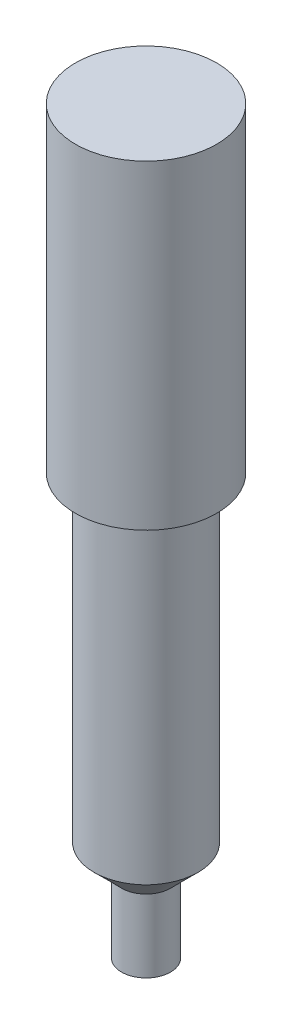
from build123d import *

# Parameters (mm, degrees)
SKETCH2_W     = 12.720955
SKETCH2_H     = 33.02
SKETCH2_W_2   = 5.999999938
SKETCH2_H_2   = 25.4
CHAMFER1_SIZE = 7.62


with BuildPart() as part:
    # Sketch2 → Revolve1 (revolve)
    with BuildSketch(Plane.XY, mode=Mode.PRIVATE) as revolve1_sk:
        with Locations((6.3604775, 86.36)):
            Rectangle(SKETCH2_W, SKETCH2_H)
        Polygon((0, 181.102), (0, 102.87), (12.720955, 102.87), (17.272, 102.87), (17.272, 181.102), align=None)
        Polygon((0, 69.85), (0, 25.4), (5.999999938, 25.4), (12.720955, 25.4), (12.720955, 69.85), align=None)
        with Locations((2.999999969, 12.7)):
            Rectangle(SKETCH2_W_2, SKETCH2_H_2)
    revolve(revolve1_sk.sketch.rotate(Axis((0, 0, 0), (0, 1, 0)), 90), axis=Axis((0, 0, 0), (0, 1, 0)))

    # Chamfer1
    # the kernel refuses this chamfer: 7.62 mm, written as the material it adds along each edge
    with BuildSketch(Plane(origin=(0, 25.4, 0), x_dir=(0, 0, -1), z_dir=(1, 0, 0))) as chamfer1_piece_1_section:
        Polygon((5.999999938 + CHAMFER1_SIZE, 0), (5.999999938, -CHAMFER1_SIZE), (5.999999938, 0), align=None)
    chamfer1_piece_1 = revolve(axis=Axis((0, 25.4, 0), (0, 1, 0)), mode=Mode.PRIVATE)
    chamfer1_piece_1 = chamfer1_piece_1 & Plane(origin=(0, 21.11622986, 0), x_dir=(0, 0, -1), z_dir=(0, 1, 0)) * Cylinder(12.720955, 55, mode=Mode.PRIVATE)
    add(chamfer1_piece_1)


solid = part.part
